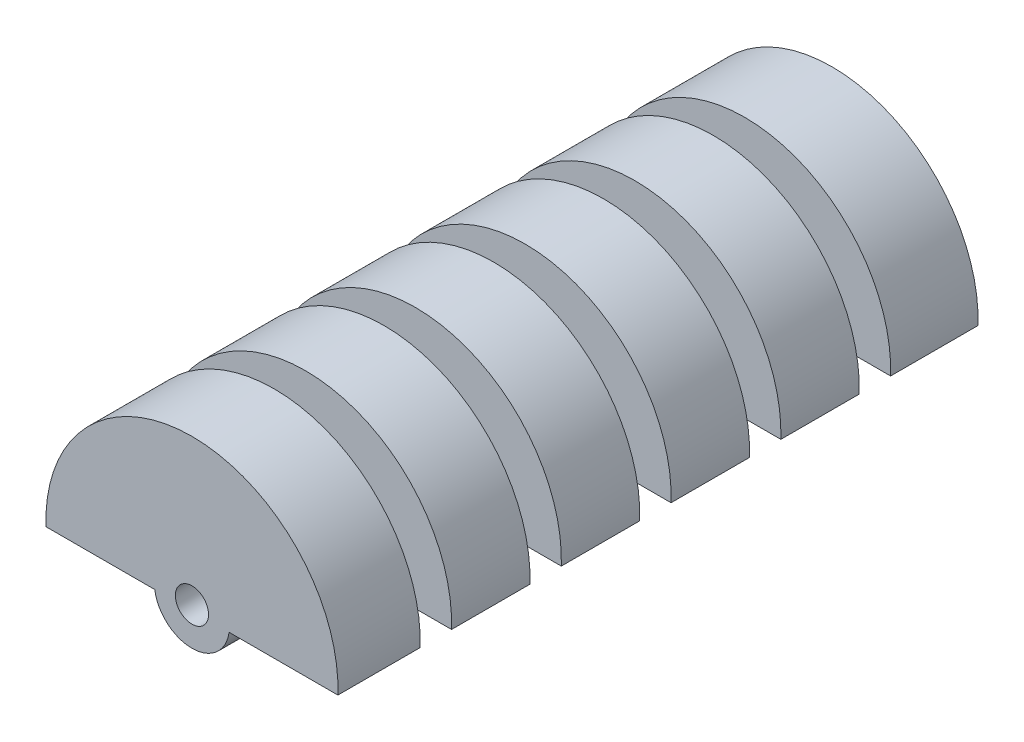
from build123d import *

# Parameters (mm, degrees)
SKETCH3_R            = 27.94
BOSS_EXTRUDE2_DEPTH  = 122.46
SKETCH5_R            = 3.175
CUT_EXTRUDE1_DEPTH   = 129.676877488
SKETCH4_W            = 14
SKETCH4_H            = 6
SHELL1_START         = 3
SHELL1_OUTLINE_R     = 10.94
SHELL1_OUTLINE_R_2   = 6.175
SHELL1_DEPTH         = 116.46
SHELL1_2_OUTLINE_R   = 24.94
SHELL1_2_OUTLINE_R_2 = 10.94
SHELL1_2_DEPTH       = 10.72
SHELL1_START_2       = 109.72
SHELL1_3_OUTLINE_R   = 24.94
SHELL1_3_OUTLINE_R_2 = 10.94
SHELL1_3_DEPTH       = 9.74
SHELL1_START_3       = 25.72
SHELL1_4_OUTLINE_R   = 24.94
SHELL1_4_OUTLINE_R_2 = 10.94
SHELL1_4_DEPTH       = 9
SHELL1_START_4       = 46.72
SHELL1_5_OUTLINE_R   = 24.94
SHELL1_5_OUTLINE_R_2 = 10.94
SHELL1_5_DEPTH       = 9
SHELL1_START_5       = 67.72
SHELL1_6_OUTLINE_R   = 24.94
SHELL1_6_OUTLINE_R_2 = 10.94
SHELL1_6_DEPTH       = 9
SHELL1_START_6       = 88.72
SHELL1_7_OUTLINE_R   = 24.94
SHELL1_7_OUTLINE_R_2 = 10.94
SHELL1_7_DEPTH       = 9
BOSS_EXTRUDE3_REACH  = 130.677
SKETCH13_W           = 16.483162312
SKETCH13_H           = 6
CUT_EXTRUDE3_DEPTH   = 123
BOSS_EXTRUDE4_DEPTH  = 122.46


# Read off the part's stored shape, not the designer's step: Shell1
with BuildPart() as part:
    # Sketch3 → Boss-Extrude2 (new body)
    with BuildSketch(Plane.XY):
        Circle(SKETCH3_R)
    extrude(amount=BOSS_EXTRUDE2_DEPTH)

    # Sketch5 → Cut-Extrude1 (cut, through all)
    with BuildSketch(Plane.XY.offset(122.46)):
        Circle(SKETCH5_R)
    extrude(amount=-CUT_EXTRUDE1_DEPTH, mode=Mode.SUBTRACT)

    # Sketch4 → Cut-Revolve1 (revolve, cut)
    with BuildSketch(Plane(origin=(0, 0, 0), x_dir=(1, 0, 0), z_dir=(0, 1, 0)), mode=Mode.PRIVATE) as cut_revolve1_sk:
        with Locations((-20.94, -103.72)):
            Rectangle(SKETCH4_W, SKETCH4_H)
        with Locations((-20.94, -82.72)):
            Rectangle(SKETCH4_W, SKETCH4_H)
        with Locations((-20.94, -61.72)):
            Rectangle(SKETCH4_W, SKETCH4_H)
        with Locations((-20.94, -40.72)):
            Rectangle(SKETCH4_W, SKETCH4_H)
        with Locations((-20.94, -19.72)):
            Rectangle(SKETCH4_W, SKETCH4_H)
    revolve(cut_revolve1_sk.sketch.rotate(Axis((0, 0, 122.46), (0, 0, -1)), 180), axis=Axis((0, 0, 122.46), (0, 0, -1)), mode=Mode.SUBTRACT)

    # Shell1 outline → Shell1 (cut)
    with BuildSketch(Plane.XY.offset(SHELL1_START)):
        Circle(SHELL1_OUTLINE_R)
        Circle(SHELL1_OUTLINE_R_2, mode=Mode.SUBTRACT)
    extrude(amount=SHELL1_DEPTH, mode=Mode.SUBTRACT)

    # Shell1 2 outline → Shell1 2 (cut)
    with BuildSketch(Plane.XY.offset(SHELL1_START)):
        Circle(SHELL1_2_OUTLINE_R)
        Circle(SHELL1_2_OUTLINE_R_2, mode=Mode.SUBTRACT)
    extrude(amount=SHELL1_2_DEPTH, mode=Mode.SUBTRACT)

    # Shell1 3 outline → Shell1 3 (cut)
    with BuildSketch(Plane.XY.offset(SHELL1_START_2)):
        Circle(SHELL1_3_OUTLINE_R)
        Circle(SHELL1_3_OUTLINE_R_2, mode=Mode.SUBTRACT)
    extrude(amount=SHELL1_3_DEPTH, mode=Mode.SUBTRACT)

    # Shell1 4 outline → Shell1 4 (cut)
    with BuildSketch(Plane.XY.offset(SHELL1_START_3)):
        Circle(SHELL1_4_OUTLINE_R)
        Circle(SHELL1_4_OUTLINE_R_2, mode=Mode.SUBTRACT)
    extrude(amount=SHELL1_4_DEPTH, mode=Mode.SUBTRACT)

    # Shell1 5 outline → Shell1 5 (cut)
    with BuildSketch(Plane.XY.offset(SHELL1_START_4)):
        Circle(SHELL1_5_OUTLINE_R)
        Circle(SHELL1_5_OUTLINE_R_2, mode=Mode.SUBTRACT)
    extrude(amount=SHELL1_5_DEPTH, mode=Mode.SUBTRACT)

    # Shell1 6 outline → Shell1 6 (cut)
    with BuildSketch(Plane.XY.offset(SHELL1_START_5)):
        Circle(SHELL1_6_OUTLINE_R)
        Circle(SHELL1_6_OUTLINE_R_2, mode=Mode.SUBTRACT)
    extrude(amount=SHELL1_6_DEPTH, mode=Mode.SUBTRACT)

    # Shell1 7 outline → Shell1 7 (cut)
    with BuildSketch(Plane.XY.offset(SHELL1_START_6)):
        Circle(SHELL1_7_OUTLINE_R)
        Circle(SHELL1_7_OUTLINE_R_2, mode=Mode.SUBTRACT)
    extrude(amount=SHELL1_7_DEPTH, mode=Mode.SUBTRACT)

    # Boss-Extrude3: up to this face of the body (flat: up to its plane)
    boss_extrude3_end = Plane(part.part.faces().sort_by_distance((-27.149737461, 0, 122.46))[0])
    # Sketch10 → Boss-Extrude3 (add, up to the picked face)
    with BuildSketch(Plane(origin=(0, 0, 0), x_dir=(-1, 0, 0), z_dir=(0, 0, -1)), mode=Mode.PRIVATE) as boss_extrude3_sk1:
        with BuildLine():
            Line((-1, 27.922098775), (-1, 3.01340754))
            ThreePointArc((-1, 3.01340754), (0, 3.175), (1, 3.01340754))
            Line((1, 3.01340754), (1, 27.922098775))
            ThreePointArc((1, 27.922098775), (0, 27.94), (-1, 27.922098775))
        make_face()
    boss_extrude3_tool1 = split(extrude(boss_extrude3_sk1.sketch, amount=-BOSS_EXTRUDE3_REACH, mode=Mode.PRIVATE), bisect_by=boss_extrude3_end, keep=Keep.BOTH, mode=Mode.PRIVATE)
    # Sketch10 → Boss-Extrude3 (add, up to the picked face)
    with BuildSketch(Plane(origin=(0, 0, 0), x_dir=(-1, 0, 0), z_dir=(0, 0, -1)), mode=Mode.PRIVATE) as boss_extrude3_sk2:
        with BuildLine():
            Line((3.01340754, 1), (27.922098775, 1))
            ThreePointArc((27.922098775, 1), (27.94, 0), (27.922098775, -1))
            Line((27.922098775, -1), (3.01340754, -1))
            ThreePointArc((3.01340754, -1), (3.175, 0), (3.01340754, 1))
        make_face()
    boss_extrude3_tool2 = split(extrude(boss_extrude3_sk2.sketch, amount=-BOSS_EXTRUDE3_REACH, mode=Mode.PRIVATE), bisect_by=boss_extrude3_end, keep=Keep.BOTH, mode=Mode.PRIVATE)
    # Sketch10 → Boss-Extrude3 (add, up to the picked face)
    with BuildSketch(Plane(origin=(0, 0, 0), x_dir=(-1, 0, 0), z_dir=(0, 0, -1)), mode=Mode.PRIVATE) as boss_extrude3_sk3:
        with BuildLine():
            Line((-1, -3.01340754), (-1, -27.922098775))
            ThreePointArc((-1, -27.922098775), (0, -27.94), (1, -27.922098775))
            Line((1, -27.922098775), (1, -3.01340754))
            ThreePointArc((1, -3.01340754), (0, -3.175), (-1, -3.01340754))
        make_face()
    boss_extrude3_tool3 = split(extrude(boss_extrude3_sk3.sketch, amount=-BOSS_EXTRUDE3_REACH, mode=Mode.PRIVATE), bisect_by=boss_extrude3_end, keep=Keep.BOTH, mode=Mode.PRIVATE)
    # Sketch10 → Boss-Extrude3 (add, up to the picked face)
    with BuildSketch(Plane(origin=(0, 0, 0), x_dir=(-1, 0, 0), z_dir=(0, 0, -1)), mode=Mode.PRIVATE) as boss_extrude3_sk4:
        with BuildLine():
            Line((-27.922098775, -1), (-3.01340754, -1))
            ThreePointArc((-3.01340754, -1), (-3.175, 0), (-3.01340754, 1))
            Line((-3.01340754, 1), (-27.922098775, 1))
            ThreePointArc((-27.922098775, 1), (-27.94, 0), (-27.922098775, -1))
        make_face()
    boss_extrude3_tool4 = split(extrude(boss_extrude3_sk4.sketch, amount=-BOSS_EXTRUDE3_REACH, mode=Mode.PRIVATE), bisect_by=boss_extrude3_end, keep=Keep.BOTH, mode=Mode.PRIVATE)
    add(boss_extrude3_tool1.solids().sort_by(Axis((0, 15.527819, 0), (0, 0, 1)))[0])
    add(boss_extrude3_tool2.solids().sort_by(Axis((-15.527819, 0, 0), (0, 0, 1)))[0])
    add(boss_extrude3_tool3.solids().sort_by(Axis((0, -15.527819, 0), (0, 0, 1)))[0])
    add(boss_extrude3_tool4.solids().sort_by(Axis((15.527819, 0, 0), (0, 0, 1)))[0])

    # Sketch13 → Cut-Revolve2 (revolve, cut)
    with BuildSketch(Plane(origin=(0, 0, 0), x_dir=(1, 0, 0), z_dir=(0, 1, 0)), mode=Mode.PRIVATE) as cut_revolve2_sk:
        with Locations((-22.145666886, -40.72)):
            Rectangle(SKETCH13_W, SKETCH13_H)
        with Locations((-22.145666886, -19.72)):
            Rectangle(SKETCH13_W, SKETCH13_H)
        with Locations((-22.145666886, -61.72)):
            Rectangle(SKETCH13_W, SKETCH13_H)
        with Locations((-22.145666886, -82.72)):
            Rectangle(SKETCH13_W, SKETCH13_H)
        with Locations((-22.145666886, -103.72)):
            Rectangle(SKETCH13_W, SKETCH13_H)
    revolve(cut_revolve2_sk.sketch.rotate(Axis((0, 0, 121.588746248), (0, 0, -1)), 180), axis=Axis((0, 0, 121.588746248), (0, 0, -1)), mode=Mode.SUBTRACT)

    # Sketch16 → Cut-Extrude3 (cut)
    with BuildSketch(Plane(origin=(0, 0, 0), x_dir=(-1, 0, 0), z_dir=(0, 0, -1))):
        with BuildLine():
            Line((-27.923120749, -0.971044624), (-6.098171639, -0.971044624))
            ThreePointArc((-6.098171639, -0.971044624), (-0.014665674, -6.174982584), (6.093490379, -1))
            Line((6.093490379, -1), (27.922098775, -1))
            ThreePointArc((27.922098775, -1), (-0.014486703, -27.939996244), (-27.923120749, -0.971044624))
        make_face()
    extrude(amount=-CUT_EXTRUDE3_DEPTH, mode=Mode.SUBTRACT)

    # Sketch17 → Boss-Extrude4 (add)
    with BuildSketch(Plane(origin=(0, 0, 0), x_dir=(-1, 0, 0), z_dir=(0, 0, -1))):
        with BuildLine():
            Line((-6.098171639, -0.971044624), (-7.108987082, -0.971044624))
            ThreePointArc((-7.108987082, -0.971044624), (-0.014616223, -7.174985113), (7.104971851, -1))
            Line((7.104971851, -1), (6.093490379, -1))
            ThreePointArc((6.093490379, -1), (-0.014665674, -6.174982584), (-6.098171639, -0.971044624))
        make_face()
    extrude(amount=-BOSS_EXTRUDE4_DEPTH)


solid = part.part
